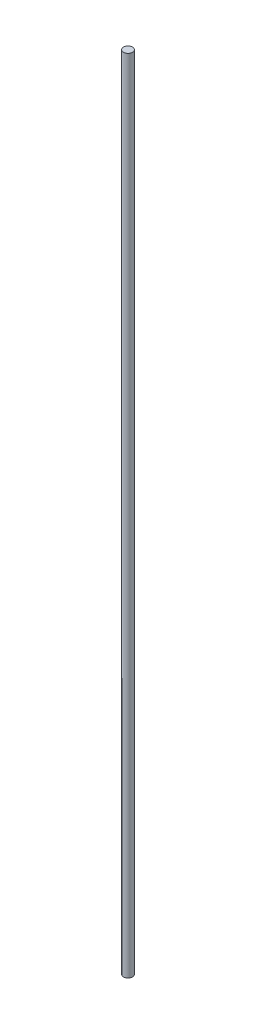
from build123d import *

# Parameters (mm, degrees)
SKETCH1_R           = 5.08
BOSS_EXTRUDE1_DEPTH = 901.7


with BuildPart() as part:
    # Sketch1 → Boss-Extrude1 (new body)
    with BuildSketch(Plane(origin=(0, 0, 0), x_dir=(1, 0, 0), z_dir=(0, 1, 0))):
        Circle(SKETCH1_R)
    extrude(amount=BOSS_EXTRUDE1_DEPTH)


solid = part.part
